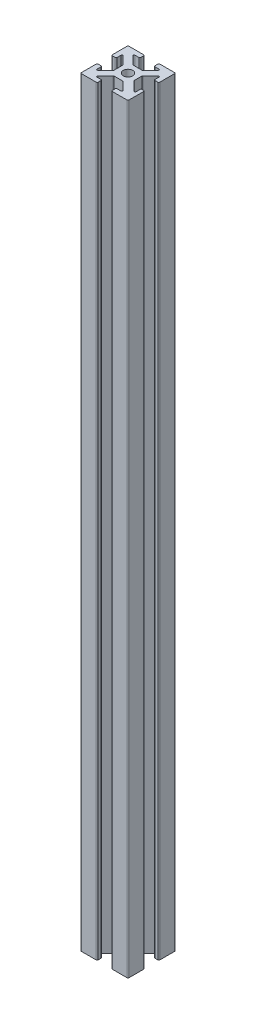
from build123d import *

# Parameters (mm, degrees)
ESQUISSE1_R        = 2
BOSS_EXTRU_1_DEPTH = 320
CONG_1_R           = 0.4


with BuildPart() as part:
    # Esquisse1 → Boss.-Extru.1 (new body)
    with BuildSketch(Plane(origin=(0, 0, 0), x_dir=(1, 0, 0), z_dir=(0, 1, 0))):
        Polygon((0, 0), (0, 7), (2, 7), (2, 4), (6, 8), (6, 12), (2, 16), (2, 13), (0, 13), (0, 20), (7, 20), (7, 18), (4, 18), (8, 14), (12, 14), (16, 18), (13, 18), (13, 20), (20, 20), (20, 13), (18, 13), (18, 16), (14, 12), (14, 8.5), (18.5, 4), (18.5, 7), (20, 7), (20, 0), (13, 0), (13, 2), (16, 2), (12, 6), (8, 6), (4, 2), (7, 2), (7, 0), align=None)
        with Locations((10, 10)):
            Circle(ESQUISSE1_R, mode=Mode.SUBTRACT)
    extrude(amount=BOSS_EXTRU_1_DEPTH)

    # Congé1
    cong_1_edges = [part.edges().sort_by_distance(p)[0] for p in [
        (4, 160, -18),
        (2, 160, -16),
        (6, 160, -12),
        (6, 160, -8),
        (2, 160, -4),
        (2, 160, -7),
        (0, 160, -7),
        (0, 160, 0),
        (7, 160, 0),
        (7, 160, -2),
        (4, 160, -2),
        (8, 160, -6),
        (12, 160, -6),
        (16, 160, -2),
        (13, 160, -2),
        (13, 160, 0),
        (20, 160, 0),
        (20, 160, -7),
        (18.5, 160, -7),
        (18.5, 160, -4),
        (14, 160, -8.5),
        (14, 160, -12),
        (18, 160, -16),
        (18, 160, -13),
        (20, 160, -13),
        (20, 160, -20),
        (13, 160, -20),
        (13, 160, -18),
        (16, 160, -18),
        (12, 160, -14),
        (8, 160, -14),
        (7, 160, -18),
        (7, 160, -20),
        (0, 160, -20),
        (0, 160, -13),
        (2, 160, -13),
    ]]
    fillet(cong_1_edges, radius=CONG_1_R)


solid = part.part
